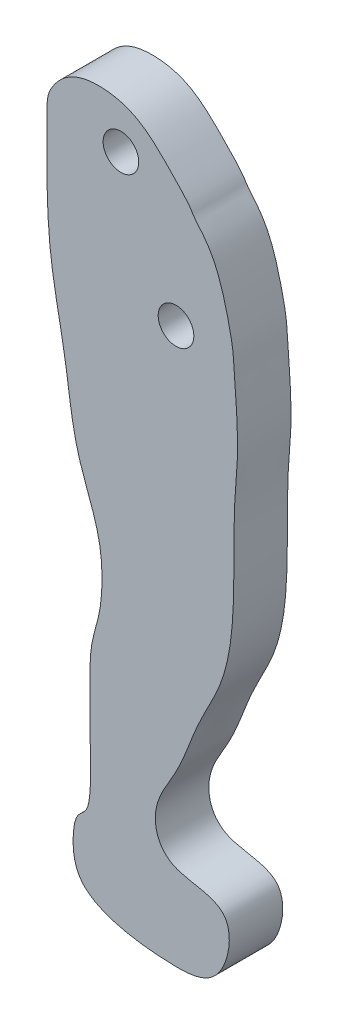
from build123d import *

# Parameters (mm, degrees)
SKETCH1_R           = 1
BOSS_EXTRUDE1_DEPTH = 3


with BuildPart() as part:
    # Sketch1 → Boss-Extrude1 (new body)
    with BuildSketch(Plane.XY):
        with BuildLine():
            add(Edge.make_bspline(
                [(-15.411513637, 11.021782626), (-15.123112254, 11.422102972), (-14.203422954, 12.392340221), (-10.976537235, 12.154887453), (-7.273718492, 8.502672721), (-8.167062981, 9.079758701), (-6.236892218, 7.022542948), (-5.336248108, 3.129605998), (-5.377814495, 2.672352828), (-5.019203417, -1.664189221), (-5.414108129, -4.257172527), (-5.24859045, -8.987419102), (-5.668338899, -13.026829177), (-7.500872482, -16.095685009), (-8.337314546, -18.873593615), (-10.139964565, -21.232360906), (-9.284633242, -24.08322285), (-5.068483288, -23.800089892), (-5.952150064, -28.414073986), (-8.639724089, -28.482788564), (-11.64394627, -28.212067719), (-14.357654474, -27.20233217), (-14.433172688, -22.799587736), (-13.317861981, -24.428506874), (-13.476151883, -15.276711266), (-13.433014187, -15.524217042), (-12.740816905, -12.851750681), (-12.618962652, -9.663655478), (-14.312361904, -6.354165435), (-14.719829303, -1.992140795), (-15.692383645, 2.250133972), (-15.858151484, 5.87730877), (-15.805923519, 9.755914439), (-15.833904444, 10.435476029), (-15.411513637, 11.021782626)],
                knots=[0, 0, 0, 0, 0.01785989, 0.033405883, 0.045862843, 0.094554936, 0.116870393, 0.140450718, 0.165653047, 0.183318594, 0.216976075, 0.265684426, 0.311895963, 0.337994116, 0.37051137, 0.398545978, 0.422018679, 0.443801715, 0.463068117, 0.48504787, 0.499083225, 0.518506693, 0.536082429, 0.588519274, 0.607538812, 0.721495064, 0.738077492, 0.773363094, 0.817574883, 0.859522713, 0.900066546, 0.946512674, 0.97384252, 1, 1, 1, 1], degree=3))
        make_face()
        with Locations((-11.676777049, 9.620351061)):
            Circle(SKETCH1_R, mode=Mode.SUBTRACT)
        with Locations((-8.586653453, 2.714929967)):
            Circle(SKETCH1_R, mode=Mode.SUBTRACT)
    extrude(amount=BOSS_EXTRUDE1_DEPTH)


solid = part.part
